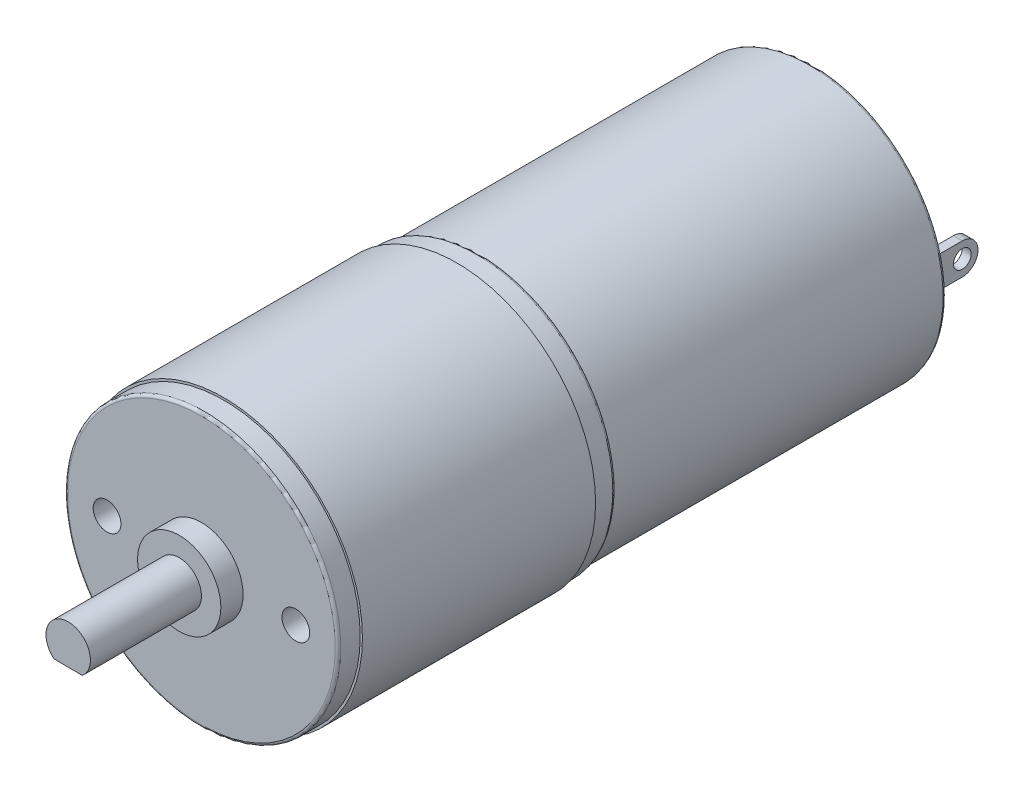
from build123d import *

# Parameters (mm, degrees)
SKETCH1_R                       = 12.3
BOSS_EXTRUDE1_DEPTH             = 2
FILLET1_R                       = 0.25
SKETCH3_R                       = 12.5
BOSS_EXTRUDE3_DEPTH             = 21
BOSS_EXTRUDE4_START             = 2
SKETCH4_R                       = 12.3
BOSS_EXTRUDE4_DEPTH             = 2
FILLET3_R                       = 0.25
SKETCH5_R                       = 12.05
BOSS_EXTRUDE5_DEPTH             = 30
FILLET4_R                       = 0.25
SKETCH6_W                       = 0.807133711
SKETCH6_H                       = 2.824967988
BOSS_EXTRUDE6_DEPTH             = 5
SKETCH7_R                       = 0.8
CUT_EXTRUDE1_DEPTH              = 64.48638172
SKETCH8_R                       = 2.5
BOSS_EXTRUDE7_DEPTH             = 0.5
SKETCH9_R                       = 3.75
BOSS_EXTRUDE8_DEPTH             = 2
BOSS_EXTRUDE9_DEPTH             = 10
TAP_DRILL_FOR_M3X0_5_TAP1_D     = 2.5
TAP_DRILL_FOR_M3X0_5_TAP1_DEPTH = 10


with BuildPart() as part:
    # Sketch1 → Boss-Extrude1 (new body)
    with BuildSketch(Plane.XY):
        Circle(SKETCH1_R)
    extrude(amount=BOSS_EXTRUDE1_DEPTH)

    # Fillet1
    fillet1_edges = [part.edges().sort_by_distance(p)[0] for p in [
        (-12.3, 0, 2),
    ]]
    fillet(fillet1_edges, radius=FILLET1_R)

    # Sketch3 → Boss-Extrude3 (add)
    with BuildSketch(Plane(origin=(0, 0, 0), x_dir=(-1, 0, 0), z_dir=(0, 0, -1))):
        Circle(SKETCH3_R)
    extrude(amount=BOSS_EXTRUDE3_DEPTH)

    # Sketch4 → Boss-Extrude4 (add)
    with BuildSketch(Plane(origin=(0, 0, -21), x_dir=(-1, 0, 0), z_dir=(0, 0, -1)).offset(BOSS_EXTRUDE4_START)):
        Circle(SKETCH4_R)
    extrude(amount=-BOSS_EXTRUDE4_DEPTH)

    # Fillet3
    fillet3_edges = [part.edges().sort_by_distance(p)[0] for p in [
        (12.3, 0, -23),
    ]]
    fillet(fillet3_edges, radius=FILLET3_R)

    # Sketch5 → Boss-Extrude5 (add)
    with BuildSketch(Plane(origin=(0, 0, -23), x_dir=(-1, 0, 0), z_dir=(0, 0, -1))):
        Circle(SKETCH5_R)
    extrude(amount=BOSS_EXTRUDE5_DEPTH)

    # Fillet4
    fillet4_edges = [part.edges().sort_by_distance(p)[0] for p in [
        (12.05, 0, -53),
    ]]
    fillet(fillet4_edges, radius=FILLET4_R)

    # Sketch6 → Boss-Extrude6 (add)
    with BuildSketch(Plane(origin=(0, 0, -53), x_dir=(-1, 0, 0), z_dir=(0, 0, -1))):
        with Locations((-9.685604531, 0.126114642)):
            Rectangle(SKETCH6_W, SKETCH6_H)
        with Locations((9.685604531, 0.126114642)):
            Rectangle(SKETCH6_W, SKETCH6_H)
    extrude(amount=BOSS_EXTRUDE6_DEPTH)

    # Sketch7 → Cut-Extrude1 (cut, through all)
    with BuildSketch(Plane(origin=(10.089171386, 0, 0), x_dir=(0, 0, -1), z_dir=(1, 0, 0))):
        with Locations((56.439265275, 0.126114642)):
            Circle(SKETCH7_R)
        with BuildLine():
            Line((56.439265275, 1.538598636), (58, 1.538598636))
            Line((58, 1.538598636), (58, -1.286369352))
            Line((58, -1.286369352), (56.439265275, -1.286369352))
            ThreePointArc((56.439265275, -1.286369352), (57.851749269, 0.126114642), (56.439265275, 1.538598636))
        make_face()
    extrude(amount=-CUT_EXTRUDE1_DEPTH, mode=Mode.SUBTRACT)

    # Sketch8 → Boss-Extrude7 (add)
    with BuildSketch(Plane(origin=(0, 0, -53), x_dir=(-1, 0, 0), z_dir=(0, 0, -1))):
        Circle(SKETCH8_R)
    extrude(amount=BOSS_EXTRUDE7_DEPTH)

    # Sketch9 → Boss-Extrude8 (add)
    with BuildSketch(Plane.XY.offset(2)):
        Circle(SKETCH9_R)
    extrude(amount=BOSS_EXTRUDE8_DEPTH)

    # Sketch10 → Boss-Extrude9 (add)
    with BuildSketch(Plane.XY.offset(4)):
        with BuildLine():
            Line((-1.288271492, -1.529822396), (1.262174935, -1.551423357))
            ThreePointArc((1.262174935, -1.551423357), (0.016938357, 1.999928272), (-1.288271492, -1.529822396))
        make_face()
    extrude(amount=BOSS_EXTRUDE9_DEPTH)

    # Tap Drill for M3x0.5 Tap1
    with Locations(Plane.XY.offset(2)):
        with Locations((8.5, 0), (-8.5, 0)):
            Hole(TAP_DRILL_FOR_M3X0_5_TAP1_D / 2, depth=TAP_DRILL_FOR_M3X0_5_TAP1_DEPTH)


solid = part.part
